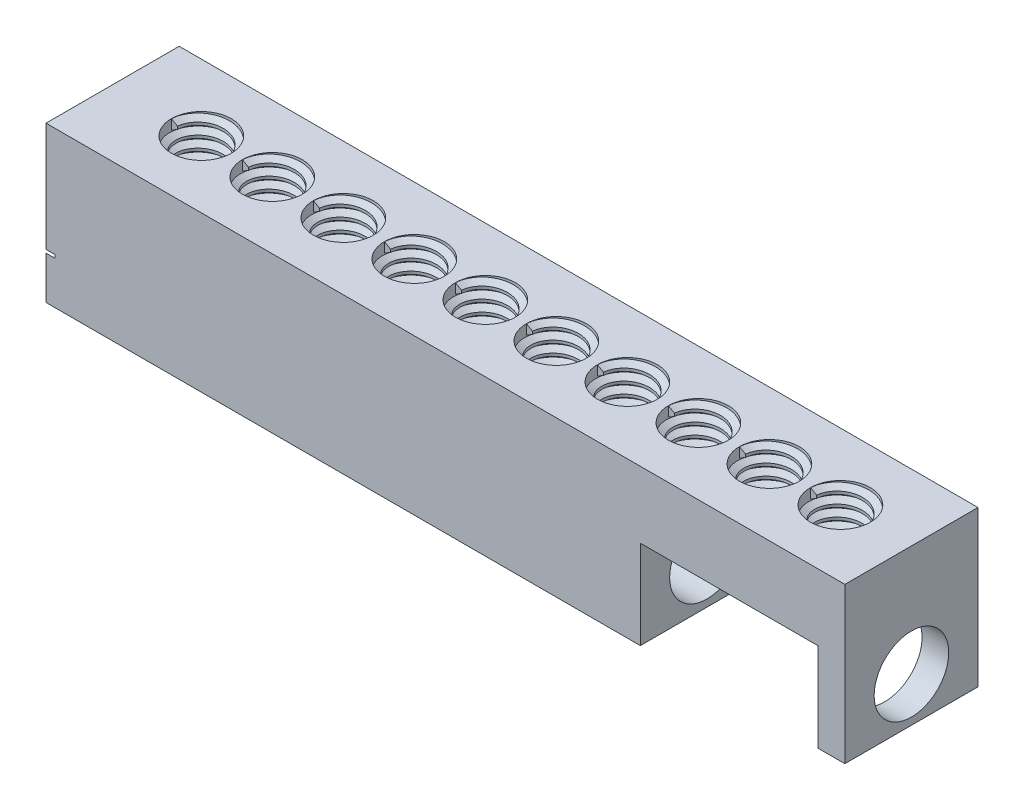
from build123d import *
from build123d.topology import SkipClean

# Parameters (mm, degrees)
EXTRUDE_1_DEPTH        = 17.5
SKETCH_2_R             = 4.200000000000001
CUT_EXTRUDE_1_DEPTH    = 93.90452088031023
CUT_EXTRUDE_2_DEPTH    = 10
SKETCH_4_R             = 3.3750000000000004
CUT_EXTRUDE_3_DEPTH    = 7.5
THREAD_1_PITCH         = 1.27
PATTERN_LINEAR_1_COUNT = 10
PATTERN_LINEAR_1_PITCH = 8
CUT_EXTRUDE_4_DEPTH    = 1


with BuildPart() as part:
    # Эскиз1 → Бобышка-Вытянуть1 (new body)
    with BuildSketch(Plane(origin=(0, 0, 0), x_dir=(1, 0, 0), z_dir=(0, 1, 0))):
        Polygon((0, 0), (90, 0), (90, -15), (3.47e-15, -15), align=None)
    extrude(amount=EXTRUDE_1_DEPTH)

    # Sketch 2 → Вырез-Вытянуть1 (cut, through all)
    with BuildSketch(Plane.ZY):
        with Locations((7.5, 5)):
            Circle(SKETCH_2_R)
    extrude(amount=-CUT_EXTRUDE_1_DEPTH, mode=Mode.SUBTRACT)

    # Эскиз3 → Вырез-Вытянуть2 (cut)
    with BuildSketch(Plane.XZ):
        Polygon((87, 15), (66.96, 14.999999999999996), (66.96, -8.67e-15), (87, -3.98e-15), align=None)
    extrude(amount=-CUT_EXTRUDE_2_DEPTH, mode=Mode.SUBTRACT)

    # Эскиз4 → Вырез-Вытянуть3 (cut)
    with BuildSketch(Plane(origin=(0, 17.5, 0), x_dir=(1, 0, 0), z_dir=(0, 1, 0))):
        with Locations(Location((82, -7.5, 0), (0, 0, 270))):
            Circle(SKETCH_4_R)
    cut_extrude_3 = extrude(amount=-CUT_EXTRUDE_3_DEPTH, mode=Mode.SUBTRACT)

    # Резьба1: the profile of Sketch 2 2 profile screwed along a right-hand helix of 4.88189 turns, 8 arcs to a turn; built about Z, then put on its axis
    thread_1_z = Axis((0, 0, 0), (0, 0, 1))
    thread_1_corners = [(3.3753, 0, -0.000173205), (3.3753, 0, 1.111423202), (2.687592339, 0, 0.714374998), (2.687592339, 0, 0.396874998)]
    with BuildLine(mode=Mode.PRIVATE) as thread_1_profile:
        Line(thread_1_corners[0], thread_1_corners[1])
        Line(thread_1_corners[1], thread_1_corners[2])
        Line(thread_1_corners[2], thread_1_corners[3])
        Line(thread_1_corners[3], thread_1_corners[0])
    thread_1_cap = Face(thread_1_profile.wire())
    thread_1_turn_angles = [0, 22.5, 45, 67.5, 90, 112.5, 135, 157.5, 180, 202.5, 225, 247.5, 270, 292.5, 315, 337.5, 360]
    thread_1_turn_weights = [1, 0.9238795325112867, 1, 0.9238795325112867, 1, 0.9238795325112867, 1, 0.9238795325112867, 1, 0.9238795325112867, 1, 0.9238795325112867, 1, 0.9238795325112867, 1, 0.9238795325112867, 1]
    thread_1_turn_rails = [Edge.make_bspline([Vector(p[0], p[1], 0).rotate(thread_1_z, thread_1_turn_angles[k]) / thread_1_turn_weights[k] + Vector(0, 0, p[2] + THREAD_1_PITCH * thread_1_turn_angles[k] / 360) for k in range(17)], [0, 0, 0, 1, 1, 2, 2, 3, 3, 4, 4, 5, 5, 6, 6, 7, 7, 8, 8, 8], 2, thread_1_turn_weights) for p in thread_1_corners]
    thread_1_turn_sides = [Face.make_surface_from_curves(thread_1_turn_rails[p[0]], thread_1_turn_rails[p[1]]) for p in [(0, 1), (1, 2), (2, 3), (3, 0)]]
    thread_1_last_angles = [1440, 1462.5, 1485, 1507.5, 1530, 1552.5, 1575, 1597.5, 1620, 1642.5, 1665, 1687.5, 1710, 1732.5, 1755, 1756.24015748, 1757.480314961]
    thread_1_last_weights = [1, 0.9238795325112867, 1, 0.9238795325112867, 1, 0.9238795325112867, 1, 0.9238795325112867, 1, 0.9238795325112867, 1, 0.9238795325112867, 1, 0.9238795325112867, 1, 0.9997657597848618, 1]
    thread_1_last_rails = [Edge.make_bspline([Vector(p[0], p[1], 0).rotate(thread_1_z, thread_1_last_angles[k]) / thread_1_last_weights[k] + Vector(0, 0, p[2] + THREAD_1_PITCH * thread_1_last_angles[k] / 360) for k in range(17)], [0, 0, 0, 1, 1, 2, 2, 3, 3, 4, 4, 5, 5, 6, 6, 7, 7, 8, 8, 8], 2, thread_1_last_weights) for p in thread_1_corners]
    thread_1_last_sides = [Face.make_surface_from_curves(thread_1_last_rails[p[0]], thread_1_last_rails[p[1]]) for p in [(0, 1), (1, 2), (2, 3), (3, 0)]]
    thread_1 = Plane(origin=(82, 17.5, 7.5), x_dir=(-1, 0, 0), z_dir=(0, -1, 0)) * Solid(Shell([*[p.moved(Location((0, 0, THREAD_1_PITCH * i))) for i in range(4) for p in thread_1_turn_sides], *thread_1_last_sides, thread_1_cap, thread_1_cap.rotate(thread_1_z, 1757.480314961).moved(Location((0, 0, THREAD_1_PITCH * 1757.480314961 / 360)))]))
    add(thread_1)

    # Линейный массив1: Вырез-Вытянуть3, Резьба1 ×10
    with SkipClean():  # the faces are left unmerged after this step: merging them gives an invalid solid
        with Locations(*[(-i * PATTERN_LINEAR_1_PITCH, 0, 0) for i in range(1, PATTERN_LINEAR_1_COUNT)]):
            add(cut_extrude_3, mode=Mode.SUBTRACT)
            add(thread_1)

    # Эскиз12 → Вырез-Вытянуть4 (cut)
    with SkipClean():  # the faces are left unmerged after this step: merging them gives an invalid solid
        with BuildSketch(Plane.ZY):
            Polygon((-0.10000000000000113, 4.999999999999999), (3.699999999999999, -1.5817930687617339), (11.299999999999999, -1.5817930687617348), (15.1, 5.000000000000003), (11.299999999999997, 11.581793068761735), (3.6999999999999993, 11.581793068761735), align=None)
        extrude(amount=-CUT_EXTRUDE_4_DEPTH, mode=Mode.SUBTRACT)


solid = part.part
